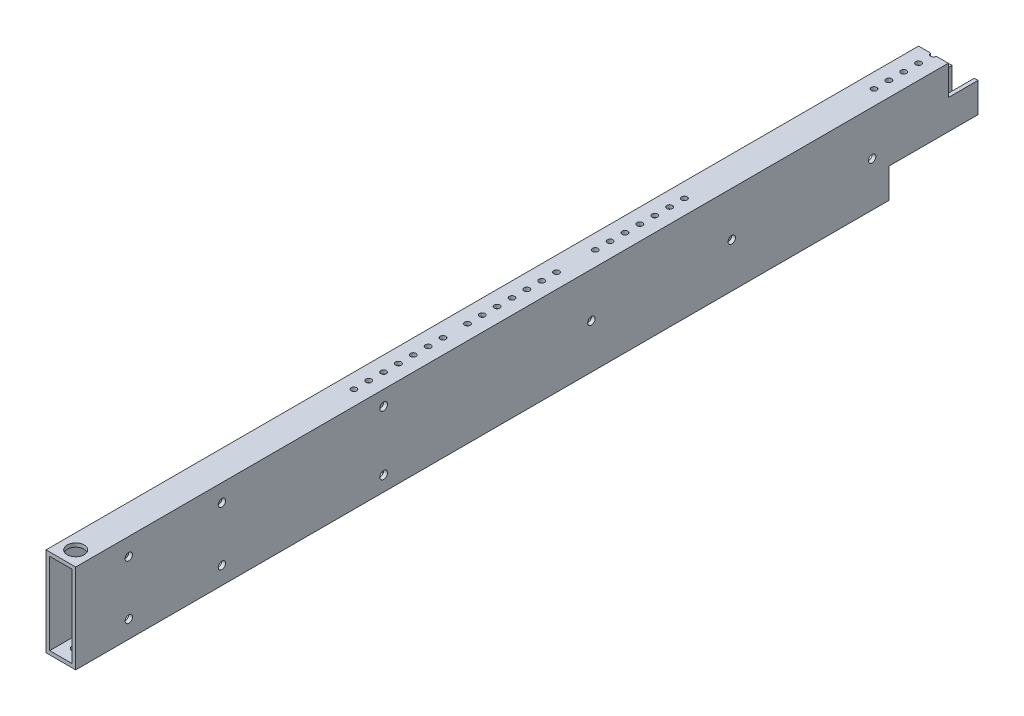
from build123d import *

# Parameters (mm, degrees)
SKETCH1_W                                    = 25.4
SKETCH1_H                                    = 76.2
BOSS_EXTRUDE1_DEPTH                          = 385.699
SHELL1_T                                     = -3.175
SKETCH2_W                                    = 76.2
SKETCH2_H                                    = 25.4
CUT_EXTRUDE1_DEPTH                           = 389.407632007
SKETCH3_W                                    = 25.4
SKETCH3_H                                    = 25.4
CUT_EXTRUDE2_DEPTH                           = 389.407632007
SKETCH4_R                                    = 2.38125
CUT_EXTRUDE3_DEPTH                           = 394.359185225
CUT_EXTRUDE4_REACH                           = 395.359
SKETCH5_R                                    = 2.38125
CUT_EXTRUDE5_REACH                           = 395.359
SKETCH6_R                                    = 2.38125
CBORE_FOR_M6_HEX_HEAD_BOLT1_D                = 6.3
CBORE_FOR_M6_HEX_HEAD_BOLT1_CBORE_D          = 14.547
CBORE_FOR_M6_HEX_HEAD_BOLT1_CBORE_DEPTH      = 4
CBORE_FOR_M6_HEX_HEAD_CAP_SCREW1_D           = 6.6
CBORE_FOR_M6_HEX_HEAD_CAP_SCREW1_CBORE_D     = 14.55
CBORE_FOR_M6_HEX_HEAD_CAP_SCREW1_CBORE_DEPTH = 4.15
CBORE_FOR_M6_HEX_HEAD_CAP_SCREW2_D           = 6.6
CBORE_FOR_M6_HEX_HEAD_CAP_SCREW2_CBORE_D     = 14.55
CBORE_FOR_M6_HEX_HEAD_CAP_SCREW2_CBORE_DEPTH = 4.15
F_6_4_6_4_DIAMETER_HOLE1_D                   = 6.4


with BuildPart() as part:
    # Sketch1 → Boss-Extrude1 (new, symmetric)
    with BuildSketch(Plane.XY):
        Rectangle(SKETCH1_W, SKETCH1_H)
    extrude(amount=BOSS_EXTRUDE1_DEPTH, both=True)

    # Shell1
    shell1_openings = [part.faces().sort_by_distance(p)[0] for p in [
        (0, 0, -385.699),
        (0, 0, 385.699),
    ]]
    offset(amount=SHELL1_T, openings=shell1_openings, kind=Kind.INTERSECTION)

    # Sketch2 → Cut-Extrude1 (cut, through all)
    with BuildSketch(Plane(origin=(12.7, 0, 0), x_dir=(0, 0, -1), z_dir=(1, 0, 0))):
        with Locations((347.599, -25.4)):
            Rectangle(SKETCH2_W, SKETCH2_H)
    extrude(amount=-CUT_EXTRUDE1_DEPTH, mode=Mode.SUBTRACT)

    # Sketch3 → Cut-Extrude2 (cut, through all)
    with BuildSketch(Plane(origin=(12.7, 0, 0), x_dir=(0, 0, -1), z_dir=(1, 0, 0))):
        with Locations((372.999, 25.4)):
            Rectangle(SKETCH3_W, SKETCH3_H)
    extrude(amount=-CUT_EXTRUDE2_DEPTH, mode=Mode.SUBTRACT)

    # Sketch4 → Cut-Extrude3 (cut, through all)
    with BuildSketch(Plane(origin=(0, 38.1, 0), x_dir=(1, 0, 0), z_dir=(0, 1, 0))):
        with Locations((0, 147.394483214)):
            Circle(SKETCH4_R)
        with Locations((0, 134.694483214)):
            Circle(SKETCH4_R)
        with Locations((0, 121.994483214)):
            Circle(SKETCH4_R)
        with Locations((0, 109.294483214)):
            Circle(SKETCH4_R)
        with Locations((0, 96.594483214)):
            Circle(SKETCH4_R)
        with Locations((0, 83.894483214)):
            Circle(SKETCH4_R)
        with Locations((0, 71.194483214)):
            Circle(SKETCH4_R)
        with Locations((0, 38.09873)):
            Circle(SKETCH4_R)
        with Locations((0, 25.39873)):
            Circle(SKETCH4_R)
        with Locations((0, 12.69873)):
            Circle(SKETCH4_R)
        with Locations((0, -0.00127)):
            Circle(SKETCH4_R)
        with Locations((0, -12.70127)):
            Circle(SKETCH4_R)
        with Locations((0, -25.40127)):
            Circle(SKETCH4_R)
        with Locations((0, -38.10127)):
            Circle(SKETCH4_R)
        with Locations((0, -58.99324371)):
            Circle(SKETCH4_R)
        with Locations((0, -71.69324371)):
            Circle(SKETCH4_R)
        with Locations((0, -84.39324371)):
            Circle(SKETCH4_R)
        with Locations((0, -97.09324371)):
            Circle(SKETCH4_R)
        with Locations((0, -109.79324371)):
            Circle(SKETCH4_R)
        with Locations((0, -122.49324371)):
            Circle(SKETCH4_R)
        with Locations((0, -135.19324371)):
            Circle(SKETCH4_R)
    extrude(amount=-CUT_EXTRUDE3_DEPTH, mode=Mode.SUBTRACT)

    # Sketch5 → Cut-Extrude4 (cut, up to next)
    with BuildSketch(Plane(origin=(0, 38.1, 0), x_dir=(1, 0, 0), z_dir=(0, 1, 0)), mode=Mode.PRIVATE) as cut_extrude4_sk1:
        with Locations((0, 360.299)):
            Circle(SKETCH5_R)
    cut_extrude4_tool1 = extrude(cut_extrude4_sk1.sketch, amount=-CUT_EXTRUDE4_REACH, mode=Mode.PRIVATE) & part.part
    # Sketch5 → Cut-Extrude4 (cut, up to next)
    with BuildSketch(Plane(origin=(0, 38.1, 0), x_dir=(1, 0, 0), z_dir=(0, 1, 0)), mode=Mode.PRIVATE) as cut_extrude4_sk2:
        with Locations((0, 347.599)):
            Circle(SKETCH5_R)
    cut_extrude4_tool2 = extrude(cut_extrude4_sk2.sketch, amount=-CUT_EXTRUDE4_REACH, mode=Mode.PRIVATE) & part.part
    # Sketch5 → Cut-Extrude4 (cut, up to next)
    with BuildSketch(Plane(origin=(0, 38.1, 0), x_dir=(1, 0, 0), z_dir=(0, 1, 0)), mode=Mode.PRIVATE) as cut_extrude4_sk3:
        with Locations((0, 334.899)):
            Circle(SKETCH5_R)
    cut_extrude4_tool3 = extrude(cut_extrude4_sk3.sketch, amount=-CUT_EXTRUDE4_REACH, mode=Mode.PRIVATE) & part.part
    # Sketch5 → Cut-Extrude4 (cut, up to next)
    with BuildSketch(Plane(origin=(0, 38.1, 0), x_dir=(1, 0, 0), z_dir=(0, 1, 0)), mode=Mode.PRIVATE) as cut_extrude4_sk4:
        with Locations((0, 322.199)):
            Circle(SKETCH5_R)
    cut_extrude4_tool4 = extrude(cut_extrude4_sk4.sketch, amount=-CUT_EXTRUDE4_REACH, mode=Mode.PRIVATE) & part.part
    # Sketch5 → Cut-Extrude4 (cut, up to next)
    with BuildSketch(Plane(origin=(0, 38.1, 0), x_dir=(1, 0, 0), z_dir=(0, 1, 0)), mode=Mode.PRIVATE) as cut_extrude4_sk5:
        with Locations((0, 309.499)):
            Circle(SKETCH5_R)
    cut_extrude4_tool5 = extrude(cut_extrude4_sk5.sketch, amount=-CUT_EXTRUDE4_REACH, mode=Mode.PRIVATE) & part.part
    add(cut_extrude4_tool1.solids().sort_by_distance((0, 38.1, -360.299))[0], mode=Mode.SUBTRACT)
    add(cut_extrude4_tool2.solids().sort_by_distance((0, 38.1, -347.599))[0], mode=Mode.SUBTRACT)
    add(cut_extrude4_tool3.solids().sort_by_distance((0, 38.1, -334.899))[0], mode=Mode.SUBTRACT)
    add(cut_extrude4_tool4.solids().sort_by_distance((0, 38.1, -322.199))[0], mode=Mode.SUBTRACT)
    add(cut_extrude4_tool5.solids().sort_by_distance((0, 38.1, -309.499))[0], mode=Mode.SUBTRACT)

    # Sketch6 → Cut-Extrude5 (cut, up to next)
    with BuildSketch(Plane.XZ.offset(38.1), mode=Mode.PRIVATE) as cut_extrude5_sk1:
        with Locations((0, -309.499)):
            Circle(SKETCH6_R)
    cut_extrude5_tool1 = extrude(cut_extrude5_sk1.sketch, amount=-CUT_EXTRUDE5_REACH, mode=Mode.PRIVATE) & part.part
    # Sketch6 → Cut-Extrude5 (cut, up to next)
    with BuildSketch(Plane.XZ.offset(38.1), mode=Mode.PRIVATE) as cut_extrude5_sk2:
        with Locations((0, -296.799)):
            Circle(SKETCH6_R)
    cut_extrude5_tool2 = extrude(cut_extrude5_sk2.sketch, amount=-CUT_EXTRUDE5_REACH, mode=Mode.PRIVATE) & part.part
    # Sketch6 → Cut-Extrude5 (cut, up to next)
    with BuildSketch(Plane.XZ.offset(38.1), mode=Mode.PRIVATE) as cut_extrude5_sk3:
        with Locations((0, -284.099)):
            Circle(SKETCH6_R)
    cut_extrude5_tool3 = extrude(cut_extrude5_sk3.sketch, amount=-CUT_EXTRUDE5_REACH, mode=Mode.PRIVATE) & part.part
    # Sketch6 → Cut-Extrude5 (cut, up to next)
    with BuildSketch(Plane.XZ.offset(38.1), mode=Mode.PRIVATE) as cut_extrude5_sk4:
        with Locations((0, -258.699)):
            Circle(SKETCH6_R)
    cut_extrude5_tool4 = extrude(cut_extrude5_sk4.sketch, amount=-CUT_EXTRUDE5_REACH, mode=Mode.PRIVATE) & part.part
    # Sketch6 → Cut-Extrude5 (cut, up to next)
    with BuildSketch(Plane.XZ.offset(38.1), mode=Mode.PRIVATE) as cut_extrude5_sk5:
        with Locations((0, -271.399)):
            Circle(SKETCH6_R)
    cut_extrude5_tool5 = extrude(cut_extrude5_sk5.sketch, amount=-CUT_EXTRUDE5_REACH, mode=Mode.PRIVATE) & part.part
    add(cut_extrude5_tool1.solids().sort_by_distance((0, -38.1, -309.499))[0], mode=Mode.SUBTRACT)
    add(cut_extrude5_tool2.solids().sort_by_distance((0, -38.1, -296.799))[0], mode=Mode.SUBTRACT)
    add(cut_extrude5_tool3.solids().sort_by_distance((0, -38.1, -284.099))[0], mode=Mode.SUBTRACT)
    add(cut_extrude5_tool4.solids().sort_by_distance((0, -38.1, -258.699))[0], mode=Mode.SUBTRACT)
    add(cut_extrude5_tool5.solids().sort_by_distance((0, -38.1, -271.399))[0], mode=Mode.SUBTRACT)

    # CBORE for M6 Hex Head Bolt1 (through all)
    with Locations(Plane.ZY.offset(12.7)):
        with Locations((260.7244, 23.1254), (260.7244, -23.1), (340.3244, 23.1254), (340.3244, -23.1)):
            CounterBoreHole(CBORE_FOR_M6_HEX_HEAD_BOLT1_D / 2, CBORE_FOR_M6_HEX_HEAD_BOLT1_CBORE_D / 2, CBORE_FOR_M6_HEX_HEAD_BOLT1_CBORE_DEPTH)

    # CBORE for M6 Hex Head Cap Screw1 (through all)
    with Locations(Plane.ZY.offset(12.7)):
        with Locations((122.46784244, 25.4), (122.46784244, -25.4)):
            CounterBoreHole(CBORE_FOR_M6_HEX_HEAD_CAP_SCREW1_D / 2, CBORE_FOR_M6_HEX_HEAD_CAP_SCREW1_CBORE_D / 2, CBORE_FOR_M6_HEX_HEAD_CAP_SCREW1_CBORE_DEPTH)

    # CBORE for M6 Hex Head Cap Screw2 (through all)
    with Locations(Plane(origin=(0, 38.1, 0), x_dir=(1, 0, 0), z_dir=(0, 1, 0))):
        with Locations((0, -372.999)):
            CounterBoreHole(CBORE_FOR_M6_HEX_HEAD_CAP_SCREW2_D / 2, CBORE_FOR_M6_HEX_HEAD_CAP_SCREW2_CBORE_D / 2, CBORE_FOR_M6_HEX_HEAD_CAP_SCREW2_CBORE_DEPTH)

    # Ø6.4 (6.4) Diameter Hole1 (through all)
    with Locations(Plane(origin=(12.7, 0, 0), x_dir=(0, 0, -1), z_dir=(1, 0, 0))):
        with Locations((55.194871949, 0), (175.194871949, 0), (295.194871949, 0)):
            Hole(F_6_4_6_4_DIAMETER_HOLE1_D / 2)


solid = part.part
